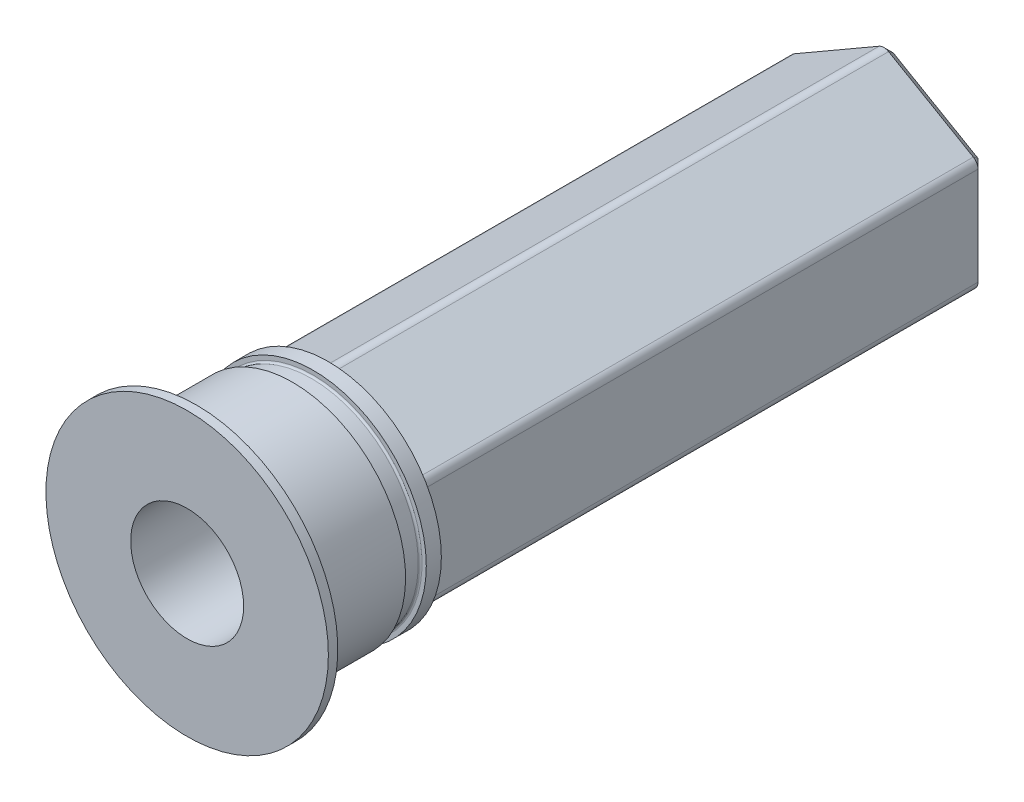
from build123d import *

# Parameters (mm, degrees)
SKETCH1_R             = 10.5
SKETCH1_R_2           = 3
EXTRUDE1_DEPTH        = 46.5
SKETCH1_3_R           = 3
CUT_EXTRUDE1_DEPTH    = 49.813420286
CUT_EXTRUDE4_DEPTH    = 8.5
CUT_EXTRUDE6_START    = -37
SKETCH6_R             = 10.5
SKETCH6_R_2           = 6
CUT_EXTRUDE6_DEPTH    = 37
CUT_EXTRUDE7_START    = -1
SKETCH7_R             = 10.5
SKETCH7_R_2           = 7.5
CUT_EXTRUDE7_DEPTH    = 1
M4X0_7_TAPPED_HOLE1_D = 3
SKETCH8_OUTSIDE_W     = 33.82
SKETCH8_OUTSIDE_H     = 30.82
CUT_EXTRUDE8_DEPTH    = 30
FILLET1_R             = 0.5
CHAMFER1_SIZE         = 0.5
FILLET2_R             = 0.3
CHAMFER2_SIZE         = 1
SKETCH13_R            = 14.541098745
CUT_EXTRUDE9_DEPTH    = 9


with BuildPart() as part:
    # Sketch1 → Extrude1 (new body)
    # profile 1 of 2: a face of its own
    with BuildSketch(Plane.XY):
        Circle(SKETCH1_R)
        Circle(SKETCH1_R_2, mode=Mode.SUBTRACT)
    # profile 2 of 2: a face of its own
    with BuildSketch(Plane.XY):
        Circle(SKETCH1_R_2)
    extrude(amount=-EXTRUDE1_DEPTH)

    # Sketch1<3> → Cut-Extrude1 (cut, through all)
    with BuildSketch(Plane.XY):
        Circle(SKETCH1_3_R)
    extrude(amount=-CUT_EXTRUDE1_DEPTH, mode=Mode.SUBTRACT)

    # Sketch4 → Cut-Extrude4 (cut)
    with BuildSketch(Plane.XY):
        with BuildLine():
            Line((-10.24499878, 2.3), (10.24499878, 2.3))
            ThreePointArc((10.24499878, 2.3), (0, 10.5), (-10.24499878, 2.3))
        make_face()
    extrude(amount=-CUT_EXTRUDE4_DEPTH, mode=Mode.SUBTRACT)

    # Sketch6 → Cut-Extrude6 (cut)
    with BuildSketch(Plane(origin=(0, 0, -46.5), x_dir=(1, 0, 0), z_dir=(0, 0, -1)).offset(CUT_EXTRUDE6_START)):
        Circle(SKETCH6_R)
        with Locations(Location((0, 0, 0), (0, 0, 270))):
            Circle(SKETCH6_R_2, mode=Mode.SUBTRACT)
    extrude(amount=CUT_EXTRUDE6_DEPTH, mode=Mode.SUBTRACT)

    # Sketch7 → Cut-Extrude7 (cut)
    with BuildSketch(Plane(origin=(0, 0, -9.5), x_dir=(1, 0, 0), z_dir=(0, 0, -1)).offset(CUT_EXTRUDE7_START)):
        Circle(SKETCH7_R)
        with Locations(Location((0, 0, 0), (0, 0, 270))):
            Circle(SKETCH7_R_2, mode=Mode.SUBTRACT)
    extrude(amount=CUT_EXTRUDE7_DEPTH, mode=Mode.SUBTRACT)

    # M4x0.7 Tapped Hole1 (through all)
    with Locations(Plane(origin=(6.25, 2.3, -4.25), x_dir=(0, 0, 1), z_dir=(0, 1, 0))):
        with Locations((0, 0), (0, -12.5)):
            Hole(M4X0_7_TAPPED_HOLE1_D / 2)

    # Sketch8 outside → Cut-Extrude8 (cut)
    with BuildSketch(Plane(origin=(0, 0, -46.5), x_dir=(1, 0, 0), z_dir=(0, 0, -1))):
        with Locations((0, 1.5)):
            Rectangle(SKETCH8_OUTSIDE_W, SKETCH8_OUTSIDE_H)
        Polygon((0, 5.773502692), (-5, 2.886751346), (-5, -2.886751346), (0, -5.773502692), (5, -2.886751346), (5, 2.886751346), align=None, mode=Mode.SUBTRACT)
    extrude(amount=-CUT_EXTRUDE8_DEPTH, mode=Mode.SUBTRACT)

    # Fillet1
    fillet1_edges = [part.edges().sort_by_distance(p)[0] for p in [
        (5, -2.886751346, -31.5),
        (5, 2.886751346, -31.5),
        (0, 5.773502692, -31.5),
        (-5, 2.886751346, -31.5),
        (-5, -2.886751346, -31.5),
        (0, -5.773502692, -31.5),
    ]]
    fillet(fillet1_edges, radius=FILLET1_R)

    # Chamfer1
    chamfer1_edges = [part.edges().sort_by_distance(p)[0] for p in [
        (-2.5, -4.330127019, -46.5),
        (2.5, -4.330127019, -46.5),
        (-5, 0, -46.5),
        (-2.5, 4.330127019, -46.5),
        (2.5, 4.330127019, -46.5),
        (5, 0, -46.5),
        (0, -5.696152423, -46.5),
        (4.933012702, -2.848076211, -46.5),
        (4.933012702, 2.848076211, -46.5),
        (0, 5.696152423, -46.5),
        (-4.933012702, 2.848076211, -46.5),
        (-4.933012702, -2.848076211, -46.5),
    ]]
    chamfer(chamfer1_edges, length=CHAMFER1_SIZE - 0.0001)  # a hair under: the kernel refuses the full size

    # Sketch12 → Groove for ANSI B27.7 - 3AM1-12, Basic External Retaining Ring1 (revolve, cut)
    with BuildSketch(Plane(origin=(0, 0, 19.370057685), x_dir=(0, 1, 0), z_dir=(-1, 0, 0))):
        with BuildLine():
            Line((5.775, 33.970057685), (7.275, 33.970057685))
            Line((7.275, 33.970057685), (7.275, 35.070057685))
            Line((7.275, 35.070057685), (5.775, 35.070057685))
            ThreePointArc((5.775, 35.070057685), (5.704289322, 35.040768363), (5.675, 34.970057685))
            Line((5.675, 34.970057685), (5.675, 34.070057685))
            ThreePointArc((5.675, 34.070057685), (5.704289322, 33.999347007), (5.775, 33.970057685))
        make_face()
    revolve(axis=Axis((0, 0, 69.359173663), (0, 0, -1)), mode=Mode.SUBTRACT)

    # Fillet2
    fillet2_edges = [part.edges().sort_by_distance(p)[0] for p in [
        (0, -6, -9.5),
        (0, -7.5, -8.5),
    ]]
    fillet(fillet2_edges, radius=FILLET2_R)

    # Chamfer2
    chamfer2_edges = [part.edges().sort_by_distance(p)[0] for p in [
        (0, -10.5, 0),
        (0, -10.5, -8.5),
    ]]
    chamfer(chamfer2_edges, length=CHAMFER2_SIZE)

    # Sketch13 → Cut-Extrude9 (cut)
    with BuildSketch(Plane.XY):
        Circle(SKETCH13_R)
    extrude(amount=-CUT_EXTRUDE9_DEPTH, mode=Mode.SUBTRACT)


solid = part.part
